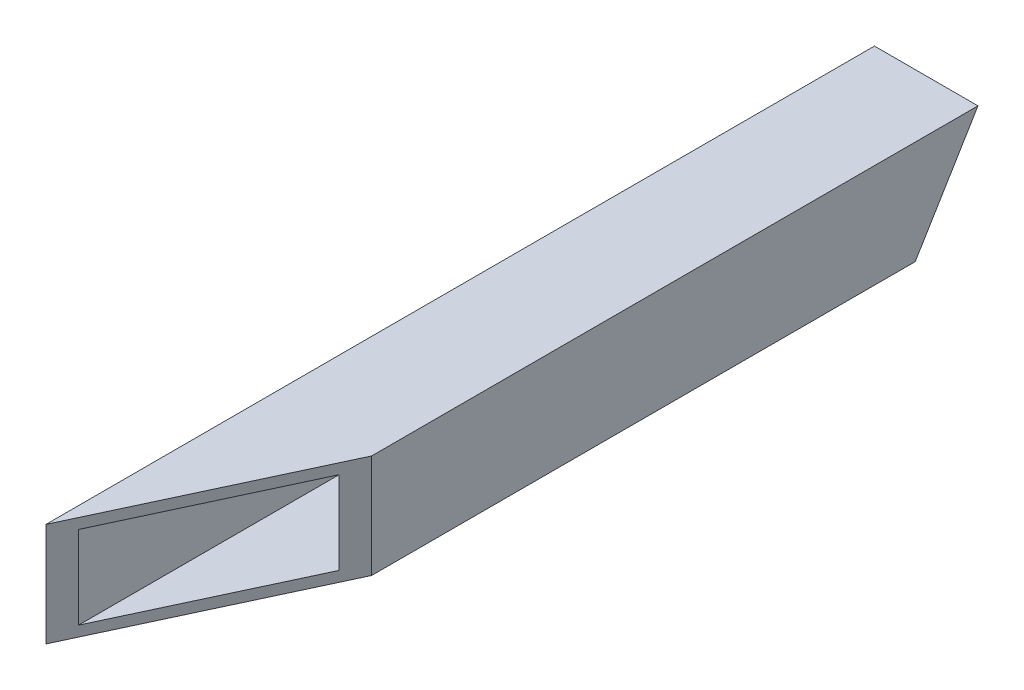
from build123d import *

# Parameters (mm, degrees)
SKETCH1_W           = 25.4
SKETCH1_H           = 25.4
SKETCH1_W_2         = 20.32
SKETCH1_H_2         = 20.32
BOSS_EXTRUDE2_DEPTH = 203.2
CUT_EXTRUDE1_DEPTH  = 206.174779152
CUT_EXTRUDE3_DEPTH  = 206.174779152


with BuildPart() as part:
    # Sketch1 → Boss-Extrude2 (new body)
    with BuildSketch(Plane.XY):
        Rectangle(SKETCH1_W, SKETCH1_H)
        Rectangle(SKETCH1_W_2, SKETCH1_H_2, mode=Mode.SUBTRACT)
    extrude(amount=BOSS_EXTRUDE2_DEPTH)

    # Sketch2 → Cut-Extrude1 (cut, through all)
    with BuildSketch(Plane(origin=(0, 12.7, 0), x_dir=(1, 0, 0), z_dir=(0, 1, 0))):
        Polygon((-12.7, -203.2), (12.7, -148.729524219), (12.7, -203.2), align=None)
    extrude(amount=-CUT_EXTRUDE1_DEPTH, mode=Mode.SUBTRACT)

    # Sketch4 → Cut-Extrude3 (cut, through all)
    with BuildSketch(Plane(origin=(12.7, 0, 0), x_dir=(0, 0, -1), z_dir=(1, 0, 0))):
        Polygon((0, 12.7), (-15.391270796, -12.7), (0, -12.7), align=None)
    extrude(amount=-CUT_EXTRUDE3_DEPTH, mode=Mode.SUBTRACT)


solid = part.part
